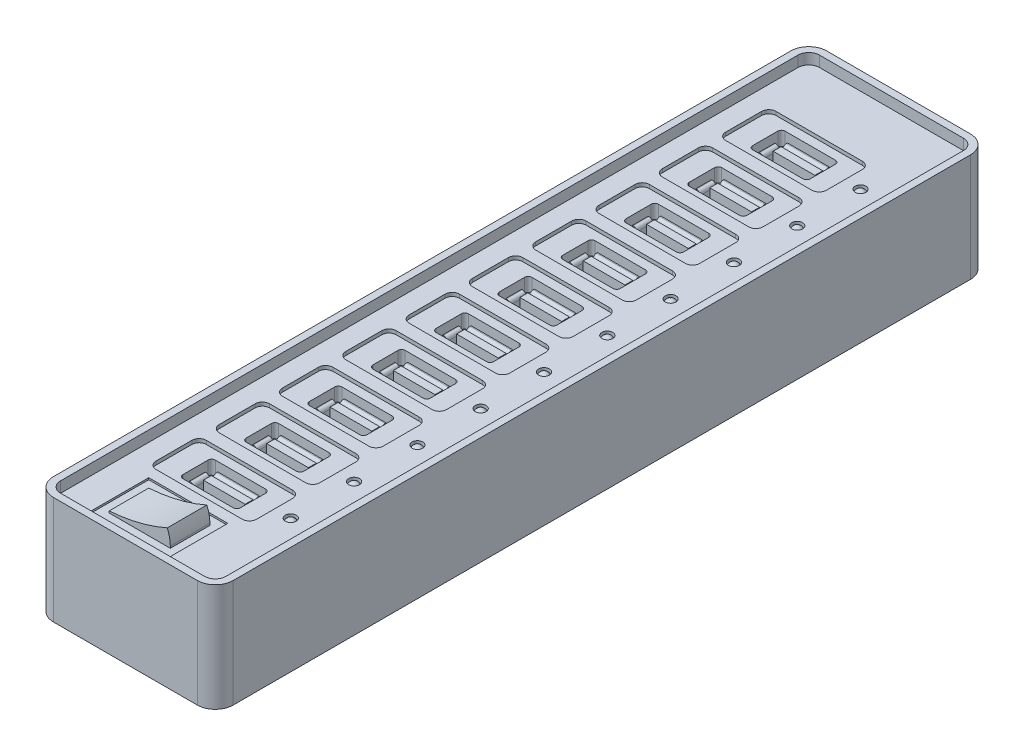
from build123d import *

# Parameters (mm, degrees)
EXTRUDE_1_DEPTH                = 30
CUT_EXTRUDE_1_DEPTH            = 3
CUT_EXTRUDE_2_DEPTH            = 1
CUT_EXTRUDE_3_DEPTH            = 2
SKETCH_5_W                     = 11.6
SKETCH_5_H                     = 2.2
CUT_EXTRUDE_4_DEPTH            = 12
FILLET_1_R                     = 1
PATTERN_LINEAR_1_COUNT         = 10
PATTERN_LINEAR_1_PITCH         = 17.6
FILLET_1_OF_PATTERN_LINEAR_1_R = 1
SKETCH_6_W                     = 22
SKETCH_6_H                     = 16
SKETCH_6_W_2                   = 17
SKETCH_6_H_2                   = 11
CUT_EXTRUDE_5_DEPTH            = 0.5
EXTRUDE_2_DEPTH                = 11


with BuildPart() as part:
    # 스케치1 → 보스-돌출1 (new body)
    with BuildSketch(Plane(origin=(0, 0, 0), x_dir=(1, 0, 0), z_dir=(0, 1, 0))):
        with BuildLine():
            Line((-20, -107.5), (20, -107.5))
            ThreePointArc((20, -107.5), (23.535533906, -106.035533906), (25, -102.5))
            Line((25, -102.5), (25, 102.5))
            ThreePointArc((25, 102.5), (23.535533906, 106.035533906), (20, 107.5))
            Line((20, 107.5), (-20, 107.5))
            ThreePointArc((-20, 107.5), (-23.535533906, 106.035533906), (-25, 102.5))
            Line((-25, 102.5), (-25, -102.5))
            ThreePointArc((-25, -102.5), (-23.535533906, -106.035533906), (-20, -107.5))
        make_face()
    extrude(amount=EXTRUDE_1_DEPTH)

    # 스케치2 → 컷-돌출1 (cut)
    with BuildSketch(Plane(origin=(0, 30, 0), x_dir=(1, 0, 0), z_dir=(0, 1, 0))):
        with BuildLine():
            Line((23, -102.5), (23, 102.5))
            ThreePointArc((23, 102.5), (22.121320344, 104.621320344), (20, 105.5))
            Line((20, 105.5), (-20, 105.5))
            ThreePointArc((-20, 105.5), (-22.121320344, 104.621320344), (-23, 102.5))
            Line((-23, 102.5), (-23, -102.5))
            ThreePointArc((-23, -102.5), (-22.121320344, -104.621320344), (-20, -105.5))
            Line((-20, -105.5), (20, -105.5))
            ThreePointArc((20, -105.5), (22.121320344, -104.621320344), (23, -102.5))
        make_face()
    extrude(amount=-CUT_EXTRUDE_1_DEPTH, mode=Mode.SUBTRACT)

    # 스케치3 → 컷-돌출2 (cut)
    with BuildSketch(Plane(origin=(0, 27, 0), x_dir=(1, 0, 0), z_dir=(0, 1, 0))):
        with BuildLine():
            Line((-15.5, -69.5), (8.5, -69.5))
            ThreePointArc((8.5, -69.5), (9.914213562, -70.085786438), (10.5, -71.5))
            Line((10.5, -71.5), (10.5, -81.5))
            ThreePointArc((10.5, -81.5), (9.914213562, -82.914213562), (8.5, -83.5))
            Line((8.5, -83.5), (-15.5, -83.5))
            ThreePointArc((-15.5, -83.5), (-16.914213562, -82.914213562), (-17.5, -81.5))
            Line((-17.5, -81.5), (-17.5, -71.5))
            ThreePointArc((-17.5, -71.5), (-16.914213562, -70.085786438), (-15.5, -69.5))
        make_face()
    cut_extrude_2 = extrude(amount=-CUT_EXTRUDE_2_DEPTH, mode=Mode.SUBTRACT)

    # 스케치4 → 컷-돌출3 (cut)
    with BuildSketch(Plane(origin=(0, 26, 0), x_dir=(1, 0, 0), z_dir=(0, 1, 0))):
        with BuildLine():
            Line((-10.5, -72), (3.5, -72))
            ThreePointArc((3.5, -72), (4.207106781, -72.292893219), (4.5, -73))
            Line((4.5, -73), (4.5, -80))
            ThreePointArc((4.5, -80), (4.207106781, -80.707106781), (3.5, -81))
            Line((3.5, -81), (-10.5, -81))
            ThreePointArc((-10.5, -81), (-11.207106781, -80.707106781), (-11.5, -80))
            Line((-11.5, -80), (-11.5, -73))
            ThreePointArc((-11.5, -73), (-11.207106781, -72.292893219), (-10.5, -72))
        make_face()
    cut_extrude_3 = extrude(amount=-CUT_EXTRUDE_3_DEPTH, mode=Mode.SUBTRACT)

    # 스케치5 → 컷-돌출4 (cut)
    # profile 1 of 2: a face of its own
    with BuildSketch(Plane(origin=(0, 24, 0), x_dir=(1, 0, 0), z_dir=(0, 1, 0))):
        with BuildLine():
            Line((3.5, -72), (-10.5, -72))
            ThreePointArc((-10.5, -72), (-11.207106781, -72.292893219), (-11.5, -73))
            Line((-11.5, -73), (-11.5, -80))
            ThreePointArc((-11.5, -80), (-11.207106781, -80.707106781), (-10.5, -81))
            Line((-10.5, -81), (3.5, -81))
            ThreePointArc((3.5, -81), (4.207106781, -80.707106781), (4.5, -80))
            Line((4.5, -80), (4.5, -73))
            ThreePointArc((4.5, -73), (4.207106781, -72.292893219), (3.5, -72))
        make_face()
        with BuildLine():
            Line((2.3, -72.5), (-9.3, -72.5))
            Line((-9.3, -72.5), (-9.3, -73.6))
            ThreePointArc((-9.3, -73.6), (-9.794974747, -73.805025253), (-10, -74.3))
            Line((-10, -74.3), (-11, -74.3))
            Line((-11, -74.3), (-11, -78.7))
            Line((-11, -78.7), (-10, -78.7))
            ThreePointArc((-10, -78.7), (-9.794974747, -79.194974747), (-9.3, -79.4))
            Line((-9.3, -79.4), (-9.3, -80.5))
            Line((-9.3, -80.5), (2.3, -80.5))
            Line((2.3, -80.5), (2.3, -79.4))
            ThreePointArc((2.3, -79.4), (2.794974747, -79.194974747), (3, -78.7))
            Line((3, -78.7), (4, -78.7))
            Line((4, -78.7), (4, -74.3))
            Line((4, -74.3), (3, -74.3))
            ThreePointArc((3, -74.3), (2.794974747, -73.805025253), (2.3, -73.6))
            Line((2.3, -73.6), (2.3, -72.5))
        make_face(mode=Mode.SUBTRACT)
    # profile 2 of 2: a face of its own
    with BuildSketch(Plane(origin=(0, 24, 0), x_dir=(1, 0, 0), z_dir=(0, 1, 0))):
        with BuildLine():
            Line((-9.3, -79.2), (2.3, -79.2))
            ThreePointArc((2.3, -79.2), (2.653553391, -79.053553391), (2.8, -78.7))
            Line((2.8, -78.7), (2.8, -74.3))
            ThreePointArc((2.8, -74.3), (2.653553391, -73.946446609), (2.3, -73.8))
            Line((2.3, -73.8), (-9.3, -73.8))
            ThreePointArc((-9.3, -73.8), (-9.653553391, -73.946446609), (-9.8, -74.3))
            Line((-9.8, -74.3), (-9.8, -78.7))
            ThreePointArc((-9.8, -78.7), (-9.653553391, -79.053553391), (-9.3, -79.2))
        make_face()
        with Locations((-3.5, -75.4)):
            Rectangle(SKETCH_5_W, SKETCH_5_H, mode=Mode.SUBTRACT)
    cut_extrude_4 = extrude(amount=-CUT_EXTRUDE_4_DEPTH, mode=Mode.SUBTRACT)

    # 필렛1
    # the kernel refuses this fillet: 1 mm, written as the material it takes off along each edge
    with BuildSketch(Plane(origin=(-9.3, 24, 78.7), x_dir=(-1, 0, 0), z_dir=(0, 0, -1))) as fillet_1_piece_1:
        with BuildLine():
            CenterArc((0.5 + FILLET_1_R, -FILLET_1_R), FILLET_1_R, 90, 90)
            Line((0.5, -FILLET_1_R), (0.5, 0))
            Line((0.5, 0), (0.5 + FILLET_1_R, 0))
        make_face()
    revolve(axis=Axis((-9.3, 24, 78.7), (0, 1, 0)), revolution_arc=90, mode=Mode.SUBTRACT)
    with BuildSketch(Plane(origin=(-9.3, 24, 79.2), x_dir=(0, 0, 1), z_dir=(1, 0, 0)), Plane(origin=(2.3, 24, 73.8), x_dir=(0, 0, -1), z_dir=(-1, 0, 0))) as fillet_1_piece_2:
        with BuildLine():
            CenterArc((FILLET_1_R, FILLET_1_R), FILLET_1_R, 180, 90)
            Line((0, FILLET_1_R), (0, 0))
            Line((0, 0), (FILLET_1_R, 0))
        make_face()
    extrude(amount=11.6, mode=Mode.SUBTRACT)
    with BuildSketch(Plane(origin=(2.3, 24, 78.7), x_dir=(0, 0, 1), z_dir=(-1, 0, 0))) as fillet_1_piece_3:
        with BuildLine():
            CenterArc((0.5 + FILLET_1_R, -FILLET_1_R), FILLET_1_R, 90, 90)
            Line((0.5, -FILLET_1_R), (0.5, 0))
            Line((0.5, 0), (0.5 + FILLET_1_R, 0))
        make_face()
    revolve(axis=Axis((2.3, 24, 78.7), (0, 1, 0)), revolution_arc=90, mode=Mode.SUBTRACT)
    with BuildSketch(Plane(origin=(2.8, 24, 78.7), x_dir=(1, 0, 0), z_dir=(0, 0, -1)), Plane(origin=(-9.8, 24, 74.3), x_dir=(-1, 0, 0), z_dir=(0, 0, 1))) as fillet_1_piece_4:
        with BuildLine():
            CenterArc((FILLET_1_R, FILLET_1_R), FILLET_1_R, 180, 90)
            Line((0, FILLET_1_R), (0, 0))
            Line((0, 0), (FILLET_1_R, 0))
        make_face()
    extrude(amount=4.4, mode=Mode.SUBTRACT)
    with BuildSketch(Plane(origin=(2.3, 24, 74.3), x_dir=(1, 0, 0), z_dir=(0, 0, 1))) as fillet_1_piece_5:
        with BuildLine():
            CenterArc((0.5 + FILLET_1_R, -FILLET_1_R), FILLET_1_R, 90, 90)
            Line((0.5, -FILLET_1_R), (0.5, 0))
            Line((0.5, 0), (0.5 + FILLET_1_R, 0))
        make_face()
    revolve(axis=Axis((2.3, 24, 74.3), (0, 1, 0)), revolution_arc=90, mode=Mode.SUBTRACT)
    with BuildSketch(Plane(origin=(-9.3, 24, 74.3), x_dir=(0, 0, -1), z_dir=(1, 0, 0))) as fillet_1_piece_6:
        with BuildLine():
            CenterArc((0.5 + FILLET_1_R, -FILLET_1_R), FILLET_1_R, 90, 90)
            Line((0.5, -FILLET_1_R), (0.5, 0))
            Line((0.5, 0), (0.5 + FILLET_1_R, 0))
        make_face()
    revolve(axis=Axis((-9.3, 24, 74.3), (0, 1, 0)), revolution_arc=90, mode=Mode.SUBTRACT)

    # 스케치8 → 컷-회전1 (revolve, cut)
    with BuildSketch(Plane.XY.offset(76.5), mode=Mode.PRIVATE) as cut_revolve_1_sk:
        with BuildLine():
            Line((16.5, 27.519218532), (15, 27.519218532))
            Line((15, 27.519218532), (15, 27))
            ThreePointArc((15, 27), (16.060660172, 26.560660172), (16.5, 25.5))
            Line((16.5, 25.5), (16.5, 27.519218532))
        make_face()
    cut_revolve_1 = revolve(cut_revolve_1_sk.sketch.rotate(Axis((15, 0, 76.5), (0, 1, 0)), 180), axis=Axis((15, 0, 76.5), (0, 1, 0)), mode=Mode.SUBTRACT)

    # 선형 패턴1: 컷-돌출2, 컷-돌출3, 컷-돌출4, 컷-회전1 ×10
    with Locations(*[(0, 0, -i * PATTERN_LINEAR_1_PITCH) for i in range(1, PATTERN_LINEAR_1_COUNT)]):
        add(cut_extrude_2, mode=Mode.SUBTRACT)
        add(cut_extrude_3, mode=Mode.SUBTRACT)
        add(cut_extrude_4, mode=Mode.SUBTRACT)
        add(cut_revolve_1, mode=Mode.SUBTRACT)

    # 필렛1 of 선형 패턴1
    # the kernel refuses this fillet: 1 mm, written as the material it takes off along each edge
    with BuildSketch(Plane(origin=(-9.3, 24, 61.1), x_dir=(-1, 0, 0), z_dir=(0, 0, -1))) as fillet_1_of_pattern_linear_1_piece_1:
        with BuildLine():
            CenterArc((0.5 + FILLET_1_OF_PATTERN_LINEAR_1_R, -FILLET_1_OF_PATTERN_LINEAR_1_R), FILLET_1_OF_PATTERN_LINEAR_1_R, 90, 90)
            Line((0.5, -FILLET_1_OF_PATTERN_LINEAR_1_R), (0.5, 0))
            Line((0.5, 0), (0.5 + FILLET_1_OF_PATTERN_LINEAR_1_R, 0))
        make_face()
    fillet_1_of_pattern_linear_1_piece_1_solid = revolve(axis=Axis((-9.3, 24, 61.1), (0, 1, 0)), revolution_arc=90, mode=Mode.PRIVATE)
    with BuildSketch(Plane(origin=(-9.3, 24, 61.6), x_dir=(0, 0, 1), z_dir=(1, 0, 0)), Plane(origin=(2.3, 24, 56.2), x_dir=(0, 0, -1), z_dir=(-1, 0, 0)), Plane(origin=(-9.3, 24, 44), x_dir=(0, 0, 1), z_dir=(1, 0, 0)), Plane(origin=(2.3, 24, 38.6), x_dir=(0, 0, -1), z_dir=(-1, 0, 0)), Plane(origin=(-9.3, 24, 26.4), x_dir=(0, 0, 1), z_dir=(1, 0, 0)), Plane(origin=(2.3, 24, 21), x_dir=(0, 0, -1), z_dir=(-1, 0, 0)), Plane(origin=(-9.3, 24, 8.8), x_dir=(0, 0, 1), z_dir=(1, 0, 0)), Plane(origin=(2.3, 24, 3.4), x_dir=(0, 0, -1), z_dir=(-1, 0, 0)), Plane(origin=(-9.3, 24, -8.8), x_dir=(0, 0, 1), z_dir=(1, 0, 0)), Plane(origin=(2.3, 24, -14.2), x_dir=(0, 0, -1), z_dir=(-1, 0, 0)), Plane(origin=(-9.3, 24, -26.4), x_dir=(0, 0, 1), z_dir=(1, 0, 0)), Plane(origin=(2.3, 24, -31.8), x_dir=(0, 0, -1), z_dir=(-1, 0, 0)), Plane(origin=(-9.3, 24, -44), x_dir=(0, 0, 1), z_dir=(1, 0, 0)), Plane(origin=(2.3, 24, -49.4), x_dir=(0, 0, -1), z_dir=(-1, 0, 0)), Plane(origin=(-9.3, 24, -61.6), x_dir=(0, 0, 1), z_dir=(1, 0, 0)), Plane(origin=(2.3, 24, -67), x_dir=(0, 0, -1), z_dir=(-1, 0, 0)), Plane(origin=(-9.3, 24, -79.2), x_dir=(0, 0, 1), z_dir=(1, 0, 0)), Plane(origin=(2.3, 24, -84.6), x_dir=(0, 0, -1), z_dir=(-1, 0, 0))) as fillet_1_of_pattern_linear_1_piece_2:
        with BuildLine():
            CenterArc((FILLET_1_OF_PATTERN_LINEAR_1_R, FILLET_1_OF_PATTERN_LINEAR_1_R), FILLET_1_OF_PATTERN_LINEAR_1_R, 180, 90)
            Line((0, FILLET_1_OF_PATTERN_LINEAR_1_R), (0, 0))
            Line((0, 0), (FILLET_1_OF_PATTERN_LINEAR_1_R, 0))
        make_face()
    fillet_1_of_pattern_linear_1_piece_2_solid = extrude(amount=11.6, mode=Mode.PRIVATE)
    with BuildSketch(Plane(origin=(2.3, 24, 61.1), x_dir=(0, 0, 1), z_dir=(-1, 0, 0))) as fillet_1_of_pattern_linear_1_piece_3:
        with BuildLine():
            CenterArc((0.5 + FILLET_1_OF_PATTERN_LINEAR_1_R, -FILLET_1_OF_PATTERN_LINEAR_1_R), FILLET_1_OF_PATTERN_LINEAR_1_R, 90, 90)
            Line((0.5, -FILLET_1_OF_PATTERN_LINEAR_1_R), (0.5, 0))
            Line((0.5, 0), (0.5 + FILLET_1_OF_PATTERN_LINEAR_1_R, 0))
        make_face()
    fillet_1_of_pattern_linear_1_piece_3_solid = revolve(axis=Axis((2.3, 24, 61.1), (0, 1, 0)), revolution_arc=90, mode=Mode.PRIVATE)
    with BuildSketch(Plane(origin=(2.8, 24, 61.1), x_dir=(1, 0, 0), z_dir=(0, 0, -1)), Plane(origin=(-9.8, 24, 56.7), x_dir=(-1, 0, 0), z_dir=(0, 0, 1)), Plane(origin=(2.8, 24, 43.5), x_dir=(1, 0, 0), z_dir=(0, 0, -1)), Plane(origin=(-9.8, 24, 39.1), x_dir=(-1, 0, 0), z_dir=(0, 0, 1)), Plane(origin=(2.8, 24, 25.9), x_dir=(1, 0, 0), z_dir=(0, 0, -1)), Plane(origin=(-9.8, 24, 21.5), x_dir=(-1, 0, 0), z_dir=(0, 0, 1)), Plane(origin=(2.8, 24, 8.3), x_dir=(1, 0, 0), z_dir=(0, 0, -1)), Plane(origin=(-9.8, 24, 3.9), x_dir=(-1, 0, 0), z_dir=(0, 0, 1)), Plane(origin=(2.8, 24, -9.3), x_dir=(1, 0, 0), z_dir=(0, 0, -1)), Plane(origin=(-9.8, 24, -13.7), x_dir=(-1, 0, 0), z_dir=(0, 0, 1)), Plane(origin=(2.8, 24, -26.9), x_dir=(1, 0, 0), z_dir=(0, 0, -1)), Plane(origin=(-9.8, 24, -31.3), x_dir=(-1, 0, 0), z_dir=(0, 0, 1)), Plane(origin=(2.8, 24, -44.5), x_dir=(1, 0, 0), z_dir=(0, 0, -1)), Plane(origin=(-9.8, 24, -48.9), x_dir=(-1, 0, 0), z_dir=(0, 0, 1)), Plane(origin=(2.8, 24, -62.1), x_dir=(1, 0, 0), z_dir=(0, 0, -1)), Plane(origin=(-9.8, 24, -66.5), x_dir=(-1, 0, 0), z_dir=(0, 0, 1)), Plane(origin=(2.8, 24, -79.7), x_dir=(1, 0, 0), z_dir=(0, 0, -1)), Plane(origin=(-9.8, 24, -84.1), x_dir=(-1, 0, 0), z_dir=(0, 0, 1))) as fillet_1_of_pattern_linear_1_piece_4:
        with BuildLine():
            CenterArc((FILLET_1_OF_PATTERN_LINEAR_1_R, FILLET_1_OF_PATTERN_LINEAR_1_R), FILLET_1_OF_PATTERN_LINEAR_1_R, 180, 90)
            Line((0, FILLET_1_OF_PATTERN_LINEAR_1_R), (0, 0))
            Line((0, 0), (FILLET_1_OF_PATTERN_LINEAR_1_R, 0))
        make_face()
    fillet_1_of_pattern_linear_1_piece_4_solid = extrude(amount=4.4, mode=Mode.PRIVATE)
    with BuildSketch(Plane(origin=(2.3, 24, 56.7), x_dir=(1, 0, 0), z_dir=(0, 0, 1))) as fillet_1_of_pattern_linear_1_piece_5:
        with BuildLine():
            CenterArc((0.5 + FILLET_1_OF_PATTERN_LINEAR_1_R, -FILLET_1_OF_PATTERN_LINEAR_1_R), FILLET_1_OF_PATTERN_LINEAR_1_R, 90, 90)
            Line((0.5, -FILLET_1_OF_PATTERN_LINEAR_1_R), (0.5, 0))
            Line((0.5, 0), (0.5 + FILLET_1_OF_PATTERN_LINEAR_1_R, 0))
        make_face()
    fillet_1_of_pattern_linear_1_piece_5_solid = revolve(axis=Axis((2.3, 24, 56.7), (0, 1, 0)), revolution_arc=90, mode=Mode.PRIVATE)
    with BuildSketch(Plane(origin=(-9.3, 24, 56.7), x_dir=(0, 0, -1), z_dir=(1, 0, 0))) as fillet_1_of_pattern_linear_1_piece_6:
        with BuildLine():
            CenterArc((0.5 + FILLET_1_OF_PATTERN_LINEAR_1_R, -FILLET_1_OF_PATTERN_LINEAR_1_R), FILLET_1_OF_PATTERN_LINEAR_1_R, 90, 90)
            Line((0.5, -FILLET_1_OF_PATTERN_LINEAR_1_R), (0.5, 0))
            Line((0.5, 0), (0.5 + FILLET_1_OF_PATTERN_LINEAR_1_R, 0))
        make_face()
    fillet_1_of_pattern_linear_1_piece_6_solid = revolve(axis=Axis((-9.3, 24, 56.7), (0, 1, 0)), revolution_arc=90, mode=Mode.PRIVATE)
    with BuildSketch(Plane(origin=(-9.3, 24, 43.5), x_dir=(-1, 0, 0), z_dir=(0, 0, -1))) as fillet_1_of_pattern_linear_1_piece_7:
        with BuildLine():
            CenterArc((0.5 + FILLET_1_OF_PATTERN_LINEAR_1_R, -FILLET_1_OF_PATTERN_LINEAR_1_R), FILLET_1_OF_PATTERN_LINEAR_1_R, 90, 90)
            Line((0.5, -FILLET_1_OF_PATTERN_LINEAR_1_R), (0.5, 0))
            Line((0.5, 0), (0.5 + FILLET_1_OF_PATTERN_LINEAR_1_R, 0))
        make_face()
    fillet_1_of_pattern_linear_1_piece_7_solid = revolve(axis=Axis((-9.3, 24, 43.5), (0, 1, 0)), revolution_arc=90, mode=Mode.PRIVATE)
    with BuildSketch(Plane(origin=(2.3, 24, 43.5), x_dir=(0, 0, 1), z_dir=(-1, 0, 0))) as fillet_1_of_pattern_linear_1_piece_8:
        with BuildLine():
            CenterArc((0.5 + FILLET_1_OF_PATTERN_LINEAR_1_R, -FILLET_1_OF_PATTERN_LINEAR_1_R), FILLET_1_OF_PATTERN_LINEAR_1_R, 90, 90)
            Line((0.5, -FILLET_1_OF_PATTERN_LINEAR_1_R), (0.5, 0))
            Line((0.5, 0), (0.5 + FILLET_1_OF_PATTERN_LINEAR_1_R, 0))
        make_face()
    fillet_1_of_pattern_linear_1_piece_8_solid = revolve(axis=Axis((2.3, 24, 43.5), (0, 1, 0)), revolution_arc=90, mode=Mode.PRIVATE)
    with BuildSketch(Plane(origin=(2.3, 24, 39.1), x_dir=(1, 0, 0), z_dir=(0, 0, 1))) as fillet_1_of_pattern_linear_1_piece_9:
        with BuildLine():
            CenterArc((0.5 + FILLET_1_OF_PATTERN_LINEAR_1_R, -FILLET_1_OF_PATTERN_LINEAR_1_R), FILLET_1_OF_PATTERN_LINEAR_1_R, 90, 90)
            Line((0.5, -FILLET_1_OF_PATTERN_LINEAR_1_R), (0.5, 0))
            Line((0.5, 0), (0.5 + FILLET_1_OF_PATTERN_LINEAR_1_R, 0))
        make_face()
    fillet_1_of_pattern_linear_1_piece_9_solid = revolve(axis=Axis((2.3, 24, 39.1), (0, 1, 0)), revolution_arc=90, mode=Mode.PRIVATE)
    with BuildSketch(Plane(origin=(-9.3, 24, 39.1), x_dir=(0, 0, -1), z_dir=(1, 0, 0))) as fillet_1_of_pattern_linear_1_piece_10:
        with BuildLine():
            CenterArc((0.5 + FILLET_1_OF_PATTERN_LINEAR_1_R, -FILLET_1_OF_PATTERN_LINEAR_1_R), FILLET_1_OF_PATTERN_LINEAR_1_R, 90, 90)
            Line((0.5, -FILLET_1_OF_PATTERN_LINEAR_1_R), (0.5, 0))
            Line((0.5, 0), (0.5 + FILLET_1_OF_PATTERN_LINEAR_1_R, 0))
        make_face()
    fillet_1_of_pattern_linear_1_piece_10_solid = revolve(axis=Axis((-9.3, 24, 39.1), (0, 1, 0)), revolution_arc=90, mode=Mode.PRIVATE)
    with BuildSketch(Plane(origin=(-9.3, 24, 25.9), x_dir=(-1, 0, 0), z_dir=(0, 0, -1))) as fillet_1_of_pattern_linear_1_piece_11:
        with BuildLine():
            CenterArc((0.5 + FILLET_1_OF_PATTERN_LINEAR_1_R, -FILLET_1_OF_PATTERN_LINEAR_1_R), FILLET_1_OF_PATTERN_LINEAR_1_R, 90, 90)
            Line((0.5, -FILLET_1_OF_PATTERN_LINEAR_1_R), (0.5, 0))
            Line((0.5, 0), (0.5 + FILLET_1_OF_PATTERN_LINEAR_1_R, 0))
        make_face()
    fillet_1_of_pattern_linear_1_piece_11_solid = revolve(axis=Axis((-9.3, 24, 25.9), (0, 1, 0)), revolution_arc=90, mode=Mode.PRIVATE)
    with BuildSketch(Plane(origin=(2.3, 24, 25.9), x_dir=(0, 0, 1), z_dir=(-1, 0, 0))) as fillet_1_of_pattern_linear_1_piece_12:
        with BuildLine():
            CenterArc((0.5 + FILLET_1_OF_PATTERN_LINEAR_1_R, -FILLET_1_OF_PATTERN_LINEAR_1_R), FILLET_1_OF_PATTERN_LINEAR_1_R, 90, 90)
            Line((0.5, -FILLET_1_OF_PATTERN_LINEAR_1_R), (0.5, 0))
            Line((0.5, 0), (0.5 + FILLET_1_OF_PATTERN_LINEAR_1_R, 0))
        make_face()
    fillet_1_of_pattern_linear_1_piece_12_solid = revolve(axis=Axis((2.3, 24, 25.9), (0, 1, 0)), revolution_arc=90, mode=Mode.PRIVATE)
    with BuildSketch(Plane(origin=(2.3, 24, 21.5), x_dir=(1, 0, 0), z_dir=(0, 0, 1))) as fillet_1_of_pattern_linear_1_piece_13:
        with BuildLine():
            CenterArc((0.5 + FILLET_1_OF_PATTERN_LINEAR_1_R, -FILLET_1_OF_PATTERN_LINEAR_1_R), FILLET_1_OF_PATTERN_LINEAR_1_R, 90, 90)
            Line((0.5, -FILLET_1_OF_PATTERN_LINEAR_1_R), (0.5, 0))
            Line((0.5, 0), (0.5 + FILLET_1_OF_PATTERN_LINEAR_1_R, 0))
        make_face()
    fillet_1_of_pattern_linear_1_piece_13_solid = revolve(axis=Axis((2.3, 24, 21.5), (0, 1, 0)), revolution_arc=90, mode=Mode.PRIVATE)
    with BuildSketch(Plane(origin=(-9.3, 24, 21.5), x_dir=(0, 0, -1), z_dir=(1, 0, 0))) as fillet_1_of_pattern_linear_1_piece_14:
        with BuildLine():
            CenterArc((0.5 + FILLET_1_OF_PATTERN_LINEAR_1_R, -FILLET_1_OF_PATTERN_LINEAR_1_R), FILLET_1_OF_PATTERN_LINEAR_1_R, 90, 90)
            Line((0.5, -FILLET_1_OF_PATTERN_LINEAR_1_R), (0.5, 0))
            Line((0.5, 0), (0.5 + FILLET_1_OF_PATTERN_LINEAR_1_R, 0))
        make_face()
    fillet_1_of_pattern_linear_1_piece_14_solid = revolve(axis=Axis((-9.3, 24, 21.5), (0, 1, 0)), revolution_arc=90, mode=Mode.PRIVATE)
    with BuildSketch(Plane(origin=(-9.3, 24, 8.3), x_dir=(-1, 0, 0), z_dir=(0, 0, -1))) as fillet_1_of_pattern_linear_1_piece_15:
        with BuildLine():
            CenterArc((0.5 + FILLET_1_OF_PATTERN_LINEAR_1_R, -FILLET_1_OF_PATTERN_LINEAR_1_R), FILLET_1_OF_PATTERN_LINEAR_1_R, 90, 90)
            Line((0.5, -FILLET_1_OF_PATTERN_LINEAR_1_R), (0.5, 0))
            Line((0.5, 0), (0.5 + FILLET_1_OF_PATTERN_LINEAR_1_R, 0))
        make_face()
    fillet_1_of_pattern_linear_1_piece_15_solid = revolve(axis=Axis((-9.3, 24, 8.3), (0, 1, 0)), revolution_arc=90, mode=Mode.PRIVATE)
    with BuildSketch(Plane(origin=(2.3, 24, 8.3), x_dir=(0, 0, 1), z_dir=(-1, 0, 0))) as fillet_1_of_pattern_linear_1_piece_16:
        with BuildLine():
            CenterArc((0.5 + FILLET_1_OF_PATTERN_LINEAR_1_R, -FILLET_1_OF_PATTERN_LINEAR_1_R), FILLET_1_OF_PATTERN_LINEAR_1_R, 90, 90)
            Line((0.5, -FILLET_1_OF_PATTERN_LINEAR_1_R), (0.5, 0))
            Line((0.5, 0), (0.5 + FILLET_1_OF_PATTERN_LINEAR_1_R, 0))
        make_face()
    fillet_1_of_pattern_linear_1_piece_16_solid = revolve(axis=Axis((2.3, 24, 8.3), (0, 1, 0)), revolution_arc=90, mode=Mode.PRIVATE)
    with BuildSketch(Plane(origin=(2.3, 24, 3.9), x_dir=(1, 0, 0), z_dir=(0, 0, 1))) as fillet_1_of_pattern_linear_1_piece_17:
        with BuildLine():
            CenterArc((0.5 + FILLET_1_OF_PATTERN_LINEAR_1_R, -FILLET_1_OF_PATTERN_LINEAR_1_R), FILLET_1_OF_PATTERN_LINEAR_1_R, 90, 90)
            Line((0.5, -FILLET_1_OF_PATTERN_LINEAR_1_R), (0.5, 0))
            Line((0.5, 0), (0.5 + FILLET_1_OF_PATTERN_LINEAR_1_R, 0))
        make_face()
    fillet_1_of_pattern_linear_1_piece_17_solid = revolve(axis=Axis((2.3, 24, 3.9), (0, 1, 0)), revolution_arc=90, mode=Mode.PRIVATE)
    with BuildSketch(Plane(origin=(-9.3, 24, 3.9), x_dir=(0, 0, -1), z_dir=(1, 0, 0))) as fillet_1_of_pattern_linear_1_piece_18:
        with BuildLine():
            CenterArc((0.5 + FILLET_1_OF_PATTERN_LINEAR_1_R, -FILLET_1_OF_PATTERN_LINEAR_1_R), FILLET_1_OF_PATTERN_LINEAR_1_R, 90, 90)
            Line((0.5, -FILLET_1_OF_PATTERN_LINEAR_1_R), (0.5, 0))
            Line((0.5, 0), (0.5 + FILLET_1_OF_PATTERN_LINEAR_1_R, 0))
        make_face()
    fillet_1_of_pattern_linear_1_piece_18_solid = revolve(axis=Axis((-9.3, 24, 3.9), (0, 1, 0)), revolution_arc=90, mode=Mode.PRIVATE)
    with BuildSketch(Plane(origin=(-9.3, 24, -9.3), x_dir=(-1, 0, 0), z_dir=(0, 0, -1))) as fillet_1_of_pattern_linear_1_piece_19:
        with BuildLine():
            CenterArc((0.5 + FILLET_1_OF_PATTERN_LINEAR_1_R, -FILLET_1_OF_PATTERN_LINEAR_1_R), FILLET_1_OF_PATTERN_LINEAR_1_R, 90, 90)
            Line((0.5, -FILLET_1_OF_PATTERN_LINEAR_1_R), (0.5, 0))
            Line((0.5, 0), (0.5 + FILLET_1_OF_PATTERN_LINEAR_1_R, 0))
        make_face()
    fillet_1_of_pattern_linear_1_piece_19_solid = revolve(axis=Axis((-9.3, 24, -9.3), (0, 1, 0)), revolution_arc=90, mode=Mode.PRIVATE)
    with BuildSketch(Plane(origin=(2.3, 24, -9.3), x_dir=(0, 0, 1), z_dir=(-1, 0, 0))) as fillet_1_of_pattern_linear_1_piece_20:
        with BuildLine():
            CenterArc((0.5 + FILLET_1_OF_PATTERN_LINEAR_1_R, -FILLET_1_OF_PATTERN_LINEAR_1_R), FILLET_1_OF_PATTERN_LINEAR_1_R, 90, 90)
            Line((0.5, -FILLET_1_OF_PATTERN_LINEAR_1_R), (0.5, 0))
            Line((0.5, 0), (0.5 + FILLET_1_OF_PATTERN_LINEAR_1_R, 0))
        make_face()
    fillet_1_of_pattern_linear_1_piece_20_solid = revolve(axis=Axis((2.3, 24, -9.3), (0, 1, 0)), revolution_arc=90, mode=Mode.PRIVATE)
    with BuildSketch(Plane(origin=(2.3, 24, -13.7), x_dir=(1, 0, 0), z_dir=(0, 0, 1))) as fillet_1_of_pattern_linear_1_piece_21:
        with BuildLine():
            CenterArc((0.5 + FILLET_1_OF_PATTERN_LINEAR_1_R, -FILLET_1_OF_PATTERN_LINEAR_1_R), FILLET_1_OF_PATTERN_LINEAR_1_R, 90, 90)
            Line((0.5, -FILLET_1_OF_PATTERN_LINEAR_1_R), (0.5, 0))
            Line((0.5, 0), (0.5 + FILLET_1_OF_PATTERN_LINEAR_1_R, 0))
        make_face()
    fillet_1_of_pattern_linear_1_piece_21_solid = revolve(axis=Axis((2.3, 24, -13.7), (0, 1, 0)), revolution_arc=90, mode=Mode.PRIVATE)
    with BuildSketch(Plane(origin=(-9.3, 24, -13.7), x_dir=(0, 0, -1), z_dir=(1, 0, 0))) as fillet_1_of_pattern_linear_1_piece_22:
        with BuildLine():
            CenterArc((0.5 + FILLET_1_OF_PATTERN_LINEAR_1_R, -FILLET_1_OF_PATTERN_LINEAR_1_R), FILLET_1_OF_PATTERN_LINEAR_1_R, 90, 90)
            Line((0.5, -FILLET_1_OF_PATTERN_LINEAR_1_R), (0.5, 0))
            Line((0.5, 0), (0.5 + FILLET_1_OF_PATTERN_LINEAR_1_R, 0))
        make_face()
    fillet_1_of_pattern_linear_1_piece_22_solid = revolve(axis=Axis((-9.3, 24, -13.7), (0, 1, 0)), revolution_arc=90, mode=Mode.PRIVATE)
    with BuildSketch(Plane(origin=(-9.3, 24, -26.9), x_dir=(-1, 0, 0), z_dir=(0, 0, -1))) as fillet_1_of_pattern_linear_1_piece_23:
        with BuildLine():
            CenterArc((0.5 + FILLET_1_OF_PATTERN_LINEAR_1_R, -FILLET_1_OF_PATTERN_LINEAR_1_R), FILLET_1_OF_PATTERN_LINEAR_1_R, 90, 90)
            Line((0.5, -FILLET_1_OF_PATTERN_LINEAR_1_R), (0.5, 0))
            Line((0.5, 0), (0.5 + FILLET_1_OF_PATTERN_LINEAR_1_R, 0))
        make_face()
    fillet_1_of_pattern_linear_1_piece_23_solid = revolve(axis=Axis((-9.3, 24, -26.9), (0, 1, 0)), revolution_arc=90, mode=Mode.PRIVATE)
    with BuildSketch(Plane(origin=(2.3, 24, -26.9), x_dir=(0, 0, 1), z_dir=(-1, 0, 0))) as fillet_1_of_pattern_linear_1_piece_24:
        with BuildLine():
            CenterArc((0.5 + FILLET_1_OF_PATTERN_LINEAR_1_R, -FILLET_1_OF_PATTERN_LINEAR_1_R), FILLET_1_OF_PATTERN_LINEAR_1_R, 90, 90)
            Line((0.5, -FILLET_1_OF_PATTERN_LINEAR_1_R), (0.5, 0))
            Line((0.5, 0), (0.5 + FILLET_1_OF_PATTERN_LINEAR_1_R, 0))
        make_face()
    fillet_1_of_pattern_linear_1_piece_24_solid = revolve(axis=Axis((2.3, 24, -26.9), (0, 1, 0)), revolution_arc=90, mode=Mode.PRIVATE)
    with BuildSketch(Plane(origin=(2.3, 24, -31.3), x_dir=(1, 0, 0), z_dir=(0, 0, 1))) as fillet_1_of_pattern_linear_1_piece_25:
        with BuildLine():
            CenterArc((0.5 + FILLET_1_OF_PATTERN_LINEAR_1_R, -FILLET_1_OF_PATTERN_LINEAR_1_R), FILLET_1_OF_PATTERN_LINEAR_1_R, 90, 90)
            Line((0.5, -FILLET_1_OF_PATTERN_LINEAR_1_R), (0.5, 0))
            Line((0.5, 0), (0.5 + FILLET_1_OF_PATTERN_LINEAR_1_R, 0))
        make_face()
    fillet_1_of_pattern_linear_1_piece_25_solid = revolve(axis=Axis((2.3, 24, -31.3), (0, 1, 0)), revolution_arc=90, mode=Mode.PRIVATE)
    with BuildSketch(Plane(origin=(-9.3, 24, -31.3), x_dir=(0, 0, -1), z_dir=(1, 0, 0))) as fillet_1_of_pattern_linear_1_piece_26:
        with BuildLine():
            CenterArc((0.5 + FILLET_1_OF_PATTERN_LINEAR_1_R, -FILLET_1_OF_PATTERN_LINEAR_1_R), FILLET_1_OF_PATTERN_LINEAR_1_R, 90, 90)
            Line((0.5, -FILLET_1_OF_PATTERN_LINEAR_1_R), (0.5, 0))
            Line((0.5, 0), (0.5 + FILLET_1_OF_PATTERN_LINEAR_1_R, 0))
        make_face()
    fillet_1_of_pattern_linear_1_piece_26_solid = revolve(axis=Axis((-9.3, 24, -31.3), (0, 1, 0)), revolution_arc=90, mode=Mode.PRIVATE)
    with BuildSketch(Plane(origin=(-9.3, 24, -44.5), x_dir=(-1, 0, 0), z_dir=(0, 0, -1))) as fillet_1_of_pattern_linear_1_piece_27:
        with BuildLine():
            CenterArc((0.5 + FILLET_1_OF_PATTERN_LINEAR_1_R, -FILLET_1_OF_PATTERN_LINEAR_1_R), FILLET_1_OF_PATTERN_LINEAR_1_R, 90, 90)
            Line((0.5, -FILLET_1_OF_PATTERN_LINEAR_1_R), (0.5, 0))
            Line((0.5, 0), (0.5 + FILLET_1_OF_PATTERN_LINEAR_1_R, 0))
        make_face()
    fillet_1_of_pattern_linear_1_piece_27_solid = revolve(axis=Axis((-9.3, 24, -44.5), (0, 1, 0)), revolution_arc=90, mode=Mode.PRIVATE)
    with BuildSketch(Plane(origin=(2.3, 24, -44.5), x_dir=(0, 0, 1), z_dir=(-1, 0, 0))) as fillet_1_of_pattern_linear_1_piece_28:
        with BuildLine():
            CenterArc((0.5 + FILLET_1_OF_PATTERN_LINEAR_1_R, -FILLET_1_OF_PATTERN_LINEAR_1_R), FILLET_1_OF_PATTERN_LINEAR_1_R, 90, 90)
            Line((0.5, -FILLET_1_OF_PATTERN_LINEAR_1_R), (0.5, 0))
            Line((0.5, 0), (0.5 + FILLET_1_OF_PATTERN_LINEAR_1_R, 0))
        make_face()
    fillet_1_of_pattern_linear_1_piece_28_solid = revolve(axis=Axis((2.3, 24, -44.5), (0, 1, 0)), revolution_arc=90, mode=Mode.PRIVATE)
    with BuildSketch(Plane(origin=(2.3, 24, -48.9), x_dir=(1, 0, 0), z_dir=(0, 0, 1))) as fillet_1_of_pattern_linear_1_piece_29:
        with BuildLine():
            CenterArc((0.5 + FILLET_1_OF_PATTERN_LINEAR_1_R, -FILLET_1_OF_PATTERN_LINEAR_1_R), FILLET_1_OF_PATTERN_LINEAR_1_R, 90, 90)
            Line((0.5, -FILLET_1_OF_PATTERN_LINEAR_1_R), (0.5, 0))
            Line((0.5, 0), (0.5 + FILLET_1_OF_PATTERN_LINEAR_1_R, 0))
        make_face()
    fillet_1_of_pattern_linear_1_piece_29_solid = revolve(axis=Axis((2.3, 24, -48.9), (0, 1, 0)), revolution_arc=90, mode=Mode.PRIVATE)
    with BuildSketch(Plane(origin=(-9.3, 24, -48.9), x_dir=(0, 0, -1), z_dir=(1, 0, 0))) as fillet_1_of_pattern_linear_1_piece_30:
        with BuildLine():
            CenterArc((0.5 + FILLET_1_OF_PATTERN_LINEAR_1_R, -FILLET_1_OF_PATTERN_LINEAR_1_R), FILLET_1_OF_PATTERN_LINEAR_1_R, 90, 90)
            Line((0.5, -FILLET_1_OF_PATTERN_LINEAR_1_R), (0.5, 0))
            Line((0.5, 0), (0.5 + FILLET_1_OF_PATTERN_LINEAR_1_R, 0))
        make_face()
    fillet_1_of_pattern_linear_1_piece_30_solid = revolve(axis=Axis((-9.3, 24, -48.9), (0, 1, 0)), revolution_arc=90, mode=Mode.PRIVATE)
    with BuildSketch(Plane(origin=(-9.3, 24, -62.1), x_dir=(-1, 0, 0), z_dir=(0, 0, -1))) as fillet_1_of_pattern_linear_1_piece_31:
        with BuildLine():
            CenterArc((0.5 + FILLET_1_OF_PATTERN_LINEAR_1_R, -FILLET_1_OF_PATTERN_LINEAR_1_R), FILLET_1_OF_PATTERN_LINEAR_1_R, 90, 90)
            Line((0.5, -FILLET_1_OF_PATTERN_LINEAR_1_R), (0.5, 0))
            Line((0.5, 0), (0.5 + FILLET_1_OF_PATTERN_LINEAR_1_R, 0))
        make_face()
    fillet_1_of_pattern_linear_1_piece_31_solid = revolve(axis=Axis((-9.3, 24, -62.1), (0, 1, 0)), revolution_arc=90, mode=Mode.PRIVATE)
    with BuildSketch(Plane(origin=(2.3, 24, -62.1), x_dir=(0, 0, 1), z_dir=(-1, 0, 0))) as fillet_1_of_pattern_linear_1_piece_32:
        with BuildLine():
            CenterArc((0.5 + FILLET_1_OF_PATTERN_LINEAR_1_R, -FILLET_1_OF_PATTERN_LINEAR_1_R), FILLET_1_OF_PATTERN_LINEAR_1_R, 90, 90)
            Line((0.5, -FILLET_1_OF_PATTERN_LINEAR_1_R), (0.5, 0))
            Line((0.5, 0), (0.5 + FILLET_1_OF_PATTERN_LINEAR_1_R, 0))
        make_face()
    fillet_1_of_pattern_linear_1_piece_32_solid = revolve(axis=Axis((2.3, 24, -62.1), (0, 1, 0)), revolution_arc=90, mode=Mode.PRIVATE)
    with BuildSketch(Plane(origin=(2.3, 24, -66.5), x_dir=(1, 0, 0), z_dir=(0, 0, 1))) as fillet_1_of_pattern_linear_1_piece_33:
        with BuildLine():
            CenterArc((0.5 + FILLET_1_OF_PATTERN_LINEAR_1_R, -FILLET_1_OF_PATTERN_LINEAR_1_R), FILLET_1_OF_PATTERN_LINEAR_1_R, 90, 90)
            Line((0.5, -FILLET_1_OF_PATTERN_LINEAR_1_R), (0.5, 0))
            Line((0.5, 0), (0.5 + FILLET_1_OF_PATTERN_LINEAR_1_R, 0))
        make_face()
    fillet_1_of_pattern_linear_1_piece_33_solid = revolve(axis=Axis((2.3, 24, -66.5), (0, 1, 0)), revolution_arc=90, mode=Mode.PRIVATE)
    with BuildSketch(Plane(origin=(-9.3, 24, -66.5), x_dir=(0, 0, -1), z_dir=(1, 0, 0))) as fillet_1_of_pattern_linear_1_piece_34:
        with BuildLine():
            CenterArc((0.5 + FILLET_1_OF_PATTERN_LINEAR_1_R, -FILLET_1_OF_PATTERN_LINEAR_1_R), FILLET_1_OF_PATTERN_LINEAR_1_R, 90, 90)
            Line((0.5, -FILLET_1_OF_PATTERN_LINEAR_1_R), (0.5, 0))
            Line((0.5, 0), (0.5 + FILLET_1_OF_PATTERN_LINEAR_1_R, 0))
        make_face()
    fillet_1_of_pattern_linear_1_piece_34_solid = revolve(axis=Axis((-9.3, 24, -66.5), (0, 1, 0)), revolution_arc=90, mode=Mode.PRIVATE)
    with BuildSketch(Plane(origin=(-9.3, 24, -79.7), x_dir=(-1, 0, 0), z_dir=(0, 0, -1))) as fillet_1_of_pattern_linear_1_piece_35:
        with BuildLine():
            CenterArc((0.5 + FILLET_1_OF_PATTERN_LINEAR_1_R, -FILLET_1_OF_PATTERN_LINEAR_1_R), FILLET_1_OF_PATTERN_LINEAR_1_R, 90, 90)
            Line((0.5, -FILLET_1_OF_PATTERN_LINEAR_1_R), (0.5, 0))
            Line((0.5, 0), (0.5 + FILLET_1_OF_PATTERN_LINEAR_1_R, 0))
        make_face()
    fillet_1_of_pattern_linear_1_piece_35_solid = revolve(axis=Axis((-9.3, 24, -79.7), (0, 1, 0)), revolution_arc=90, mode=Mode.PRIVATE)
    with BuildSketch(Plane(origin=(2.3, 24, -79.7), x_dir=(0, 0, 1), z_dir=(-1, 0, 0))) as fillet_1_of_pattern_linear_1_piece_36:
        with BuildLine():
            CenterArc((0.5 + FILLET_1_OF_PATTERN_LINEAR_1_R, -FILLET_1_OF_PATTERN_LINEAR_1_R), FILLET_1_OF_PATTERN_LINEAR_1_R, 90, 90)
            Line((0.5, -FILLET_1_OF_PATTERN_LINEAR_1_R), (0.5, 0))
            Line((0.5, 0), (0.5 + FILLET_1_OF_PATTERN_LINEAR_1_R, 0))
        make_face()
    fillet_1_of_pattern_linear_1_piece_36_solid = revolve(axis=Axis((2.3, 24, -79.7), (0, 1, 0)), revolution_arc=90, mode=Mode.PRIVATE)
    with BuildSketch(Plane(origin=(2.3, 24, -84.1), x_dir=(1, 0, 0), z_dir=(0, 0, 1))) as fillet_1_of_pattern_linear_1_piece_37:
        with BuildLine():
            CenterArc((0.5 + FILLET_1_OF_PATTERN_LINEAR_1_R, -FILLET_1_OF_PATTERN_LINEAR_1_R), FILLET_1_OF_PATTERN_LINEAR_1_R, 90, 90)
            Line((0.5, -FILLET_1_OF_PATTERN_LINEAR_1_R), (0.5, 0))
            Line((0.5, 0), (0.5 + FILLET_1_OF_PATTERN_LINEAR_1_R, 0))
        make_face()
    fillet_1_of_pattern_linear_1_piece_37_solid = revolve(axis=Axis((2.3, 24, -84.1), (0, 1, 0)), revolution_arc=90, mode=Mode.PRIVATE)
    with BuildSketch(Plane(origin=(-9.3, 24, -84.1), x_dir=(0, 0, -1), z_dir=(1, 0, 0))) as fillet_1_of_pattern_linear_1_piece_38:
        with BuildLine():
            CenterArc((0.5 + FILLET_1_OF_PATTERN_LINEAR_1_R, -FILLET_1_OF_PATTERN_LINEAR_1_R), FILLET_1_OF_PATTERN_LINEAR_1_R, 90, 90)
            Line((0.5, -FILLET_1_OF_PATTERN_LINEAR_1_R), (0.5, 0))
            Line((0.5, 0), (0.5 + FILLET_1_OF_PATTERN_LINEAR_1_R, 0))
        make_face()
    fillet_1_of_pattern_linear_1_piece_38_solid = revolve(axis=Axis((-9.3, 24, -84.1), (0, 1, 0)), revolution_arc=90, mode=Mode.PRIVATE)
    add([fillet_1_of_pattern_linear_1_piece_1_solid, fillet_1_of_pattern_linear_1_piece_2_solid, fillet_1_of_pattern_linear_1_piece_3_solid, fillet_1_of_pattern_linear_1_piece_4_solid, fillet_1_of_pattern_linear_1_piece_5_solid, fillet_1_of_pattern_linear_1_piece_6_solid, fillet_1_of_pattern_linear_1_piece_7_solid, fillet_1_of_pattern_linear_1_piece_8_solid, fillet_1_of_pattern_linear_1_piece_9_solid, fillet_1_of_pattern_linear_1_piece_10_solid, fillet_1_of_pattern_linear_1_piece_11_solid, fillet_1_of_pattern_linear_1_piece_12_solid, fillet_1_of_pattern_linear_1_piece_13_solid, fillet_1_of_pattern_linear_1_piece_14_solid, fillet_1_of_pattern_linear_1_piece_15_solid, fillet_1_of_pattern_linear_1_piece_16_solid, fillet_1_of_pattern_linear_1_piece_17_solid, fillet_1_of_pattern_linear_1_piece_18_solid, fillet_1_of_pattern_linear_1_piece_19_solid, fillet_1_of_pattern_linear_1_piece_20_solid, fillet_1_of_pattern_linear_1_piece_21_solid, fillet_1_of_pattern_linear_1_piece_22_solid, fillet_1_of_pattern_linear_1_piece_23_solid, fillet_1_of_pattern_linear_1_piece_24_solid, fillet_1_of_pattern_linear_1_piece_25_solid, fillet_1_of_pattern_linear_1_piece_26_solid, fillet_1_of_pattern_linear_1_piece_27_solid, fillet_1_of_pattern_linear_1_piece_28_solid, fillet_1_of_pattern_linear_1_piece_29_solid, fillet_1_of_pattern_linear_1_piece_30_solid, fillet_1_of_pattern_linear_1_piece_31_solid, fillet_1_of_pattern_linear_1_piece_32_solid, fillet_1_of_pattern_linear_1_piece_33_solid, fillet_1_of_pattern_linear_1_piece_34_solid, fillet_1_of_pattern_linear_1_piece_35_solid, fillet_1_of_pattern_linear_1_piece_36_solid, fillet_1_of_pattern_linear_1_piece_37_solid, fillet_1_of_pattern_linear_1_piece_38_solid], mode=Mode.SUBTRACT)

    # 스케치6 → 컷-돌출5 (cut)
    with BuildSketch(Plane(origin=(0, 27, 0), x_dir=(1, 0, 0), z_dir=(0, 1, 0))):
        with Locations((-3.5, -94.5)):
            Rectangle(SKETCH_6_W, SKETCH_6_H)
        with Locations((-3.5, -94.5)):
            Rectangle(SKETCH_6_W_2, SKETCH_6_H_2, mode=Mode.SUBTRACT)
    extrude(amount=-CUT_EXTRUDE_5_DEPTH, mode=Mode.SUBTRACT)

    # 스케치7 → 보스-돌출2 (add)
    with BuildSketch(Plane.XY.offset(100)):
        with BuildLine():
            Line((-12, 27), (5, 27))
            ThreePointArc((5, 27), (4.789063129, 29.043096437), (4.16515139, 31))
            ThreePointArc((4.16515139, 31), (-3.742633856, 28.293621484), (-12, 27))
        make_face()
    extrude(amount=-EXTRUDE_2_DEPTH)


solid = part.part
